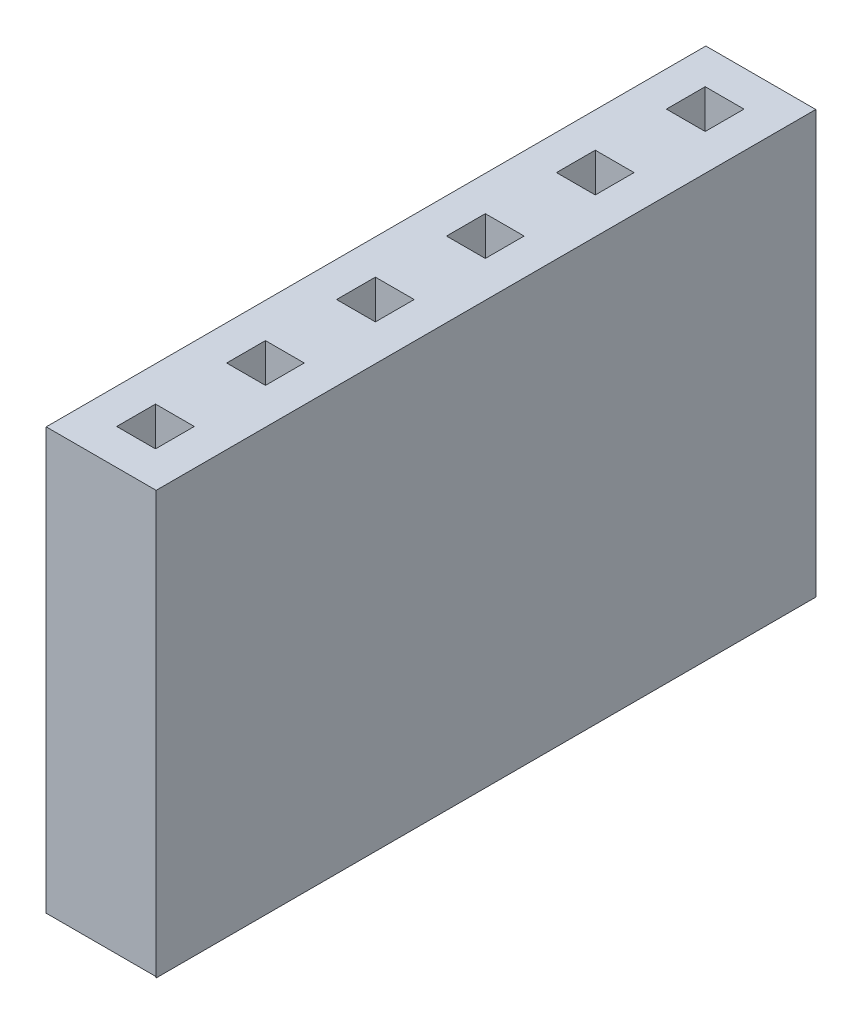
from build123d import *

# Parameters (mm, degrees)
SKETCH1_W           = 2.83333
SKETCH1_H           = 2.83333
BOSS_EXTRUDE2_DEPTH = 11
SKETCH2_W           = 1
SKETCH2_H           = 1
CUT_EXTRUDE1_DEPTH  = 11
LPATTERN6_COUNT     = 6
LPATTERN6_PITCH     = 2.8333


with BuildPart() as part:
    # Sketch1 → Boss-Extrude2 (new body)
    with BuildSketch(Plane(origin=(0, 0, 0), x_dir=(1, 0, 0), z_dir=(0, 1, 0))):
        with Locations((1.416665, 1.416665)):
            Rectangle(SKETCH1_W, SKETCH1_H)
    boss_extrude2 = extrude(amount=BOSS_EXTRUDE2_DEPTH)

    # Sketch2 → Cut-Extrude1 (cut)
    with BuildSketch(Plane(origin=(0, 0, 0), x_dir=(-1, 0, 0), z_dir=(0, -1, 0))):
        with Locations((-1.4, 1.416665)):
            Rectangle(SKETCH2_W, SKETCH2_H)
    cut_extrude1 = extrude(amount=-CUT_EXTRUDE1_DEPTH, mode=Mode.SUBTRACT)

    # Chamfer7
    # the kernel refuses this chamfer: 1.732050808, 1 mm, written as the material it takes off along each edge
    with BuildSketch(Plane(origin=(1.9, 0, -0.916665), x_dir=(0, -0.05789386240267139, 0.9983227437537926), z_dir=(-1, 0, 0)), Plane(origin=(0.9, 0, -0.916665), x_dir=(-0.9983227437537926, -0.0578938624026714, 0), z_dir=(0, 0, -1)), Plane(origin=(0.9, 0, -1.916665), x_dir=(0, -0.05789386240267139, -0.9983227437537926), z_dir=(1, 0, 0)), Plane(origin=(1.9, 0, -1.916665), x_dir=(0.9983227437537926, -0.05789386240267139, 0), z_dir=(0, 0, 1))) as chamfer7_piece_1:
        with BuildLine():
            Line((1.03637929, 0), (-0.138331657, 1.787039577))
            Line((-0.138331657, 1.787039577), (-0.172914571, 1.785034075))
            ThreePointArc((-0.172914571, 1.785034075), (-0.086457286, 0.892517037), (-0.034582914, -0.002005502))
            Line((-0.034582914, -0.002005502), (0.002005502, -0.034582914))
            ThreePointArc((0.002005502, -0.034582914), (0.518458331, -0.004633232), (1.038384792, -0.034582914))
            Line((1.038384792, -0.034582914), (1.03637929, 0))
        make_face()
    extrude(amount=1, mode=Mode.SUBTRACT)
    with BuildSketch(Plane(origin=(1.9, 0, -1.916665), x_dir=(0.9983227437537926, -0.05789386240267139, 0), z_dir=(0, 0, 1))) as chamfer7_piece_2a_section:
        with BuildLine():
            Line((1.03637929, 0), (-0.138331657, 1.787039577))
            Line((-0.138331657, 1.787039577), (-0.172914571, 1.785034075))
            ThreePointArc((-0.172914571, 1.785034075), (-0.086457286, 0.892517037), (-0.034582914, -0.002005502))
            Line((-0.034582914, -0.002005502), (0.002005502, -0.034582914))
            ThreePointArc((0.002005502, -0.034582914), (0.518458331, -0.004633232), (1.038384792, -0.034582914))
            Line((1.038384792, -0.034582914), (1.03637929, 0))
        make_face()
    chamfer7_piece_2a = extrude(amount=5.480963971, mode=Mode.PRIVATE)
    chamfer7_piece_2a = split(chamfer7_piece_2a, bisect_by=Plane(origin=(2.220669895, 0.580899134, -0.916665), z_dir=(0, 0, 1)), keep=Keep.TOP, mode=Mode.PRIVATE)
    with BuildSketch(Plane(origin=(6.380963971, 0, -0.916665), x_dir=(0, -0.05789386240267139, 0.9983227437537926), z_dir=(-1, 0, 0))) as chamfer7_piece_2b_section:
        with BuildLine():
            Line((1.03637929, 0), (-0.138331657, 1.787039577))
            Line((-0.138331657, 1.787039577), (-0.172914571, 1.785034075))
            ThreePointArc((-0.172914571, 1.785034075), (-0.086457286, 0.892517037), (-0.034582914, -0.002005502))
            Line((-0.034582914, -0.002005502), (0.002005502, -0.034582914))
            ThreePointArc((0.002005502, -0.034582914), (0.518458331, -0.004633232), (1.038384792, -0.034582914))
            Line((1.038384792, -0.034582914), (1.03637929, 0))
        make_face()
    chamfer7_piece_2b = extrude(amount=5.480963971, mode=Mode.PRIVATE)
    chamfer7_piece_2b = split(chamfer7_piece_2b, bisect_by=Plane(origin=(1.9, 0.580899134, -0.595995105), z_dir=(1, 0, 0)), keep=Keep.TOP, mode=Mode.PRIVATE)
    chamfer7_piece_2 = chamfer7_piece_2a & chamfer7_piece_2b
    add(chamfer7_piece_2, mode=Mode.SUBTRACT)
    with BuildSketch(Plane(origin=(0.9, 0, 3.564298971), x_dir=(-0.9983227437537926, -0.0578938624026714, 0), z_dir=(0, 0, -1))) as chamfer7_piece_3a_section:
        with BuildLine():
            Line((1.03637929, 0), (-0.138331657, 1.787039577))
            Line((-0.138331657, 1.787039577), (-0.172914571, 1.785034075))
            ThreePointArc((-0.172914571, 1.785034075), (-0.086457286, 0.892517037), (-0.034582914, -0.002005502))
            Line((-0.034582914, -0.002005502), (0.002005502, -0.034582914))
            ThreePointArc((0.002005502, -0.034582914), (0.518458331, -0.004633232), (1.038384792, -0.034582914))
            Line((1.038384792, -0.034582914), (1.03637929, 0))
        make_face()
    chamfer7_piece_3a = extrude(amount=5.480963971, mode=Mode.PRIVATE)
    chamfer7_piece_3a = split(chamfer7_piece_3a, bisect_by=Plane(origin=(0.579330105, 0.580899134, -0.916665), z_dir=(0, 0, 1)), keep=Keep.TOP, mode=Mode.PRIVATE)
    with BuildSketch(Plane(origin=(1.9, 0, -0.916665), x_dir=(0, -0.05789386240267139, 0.9983227437537926), z_dir=(-1, 0, 0))) as chamfer7_piece_3b_section:
        with BuildLine():
            Line((1.03637929, 0), (-0.138331657, 1.787039577))
            Line((-0.138331657, 1.787039577), (-0.172914571, 1.785034075))
            ThreePointArc((-0.172914571, 1.785034075), (-0.086457286, 0.892517037), (-0.034582914, -0.002005502))
            Line((-0.034582914, -0.002005502), (0.002005502, -0.034582914))
            ThreePointArc((0.002005502, -0.034582914), (0.518458331, -0.004633232), (1.038384792, -0.034582914))
            Line((1.038384792, -0.034582914), (1.03637929, 0))
        make_face()
    chamfer7_piece_3b = extrude(amount=5.480963971, mode=Mode.PRIVATE)
    chamfer7_piece_3b = split(chamfer7_piece_3b, bisect_by=Plane(origin=(0.9, 0.580899134, -0.595995105), z_dir=(-1, 0, 0)), keep=Keep.TOP, mode=Mode.PRIVATE)
    chamfer7_piece_3 = chamfer7_piece_3a & chamfer7_piece_3b
    add(chamfer7_piece_3, mode=Mode.SUBTRACT)
    with BuildSketch(Plane(origin=(-3.580963971, 0, -1.916665), x_dir=(0, -0.05789386240267139, -0.9983227437537926), z_dir=(1, 0, 0))) as chamfer7_piece_4a_section:
        with BuildLine():
            Line((1.03637929, 0), (-0.138331657, 1.787039577))
            Line((-0.138331657, 1.787039577), (-0.172914571, 1.785034075))
            ThreePointArc((-0.172914571, 1.785034075), (-0.086457286, 0.892517037), (-0.034582914, -0.002005502))
            Line((-0.034582914, -0.002005502), (0.002005502, -0.034582914))
            ThreePointArc((0.002005502, -0.034582914), (0.518458331, -0.004633232), (1.038384792, -0.034582914))
            Line((1.038384792, -0.034582914), (1.03637929, 0))
        make_face()
    chamfer7_piece_4a = extrude(amount=5.480963971, mode=Mode.PRIVATE)
    chamfer7_piece_4a = split(chamfer7_piece_4a, bisect_by=Plane(origin=(0.9, 0.580899134, -2.237334895), z_dir=(-1, 0, 0)), keep=Keep.TOP, mode=Mode.PRIVATE)
    with BuildSketch(Plane(origin=(0.9, 0, -0.916665), x_dir=(-0.9983227437537926, -0.0578938624026714, 0), z_dir=(0, 0, -1))) as chamfer7_piece_4b_section:
        with BuildLine():
            Line((1.03637929, 0), (-0.138331657, 1.787039577))
            Line((-0.138331657, 1.787039577), (-0.172914571, 1.785034075))
            ThreePointArc((-0.172914571, 1.785034075), (-0.086457286, 0.892517037), (-0.034582914, -0.002005502))
            Line((-0.034582914, -0.002005502), (0.002005502, -0.034582914))
            ThreePointArc((0.002005502, -0.034582914), (0.518458331, -0.004633232), (1.038384792, -0.034582914))
            Line((1.038384792, -0.034582914), (1.03637929, 0))
        make_face()
    chamfer7_piece_4b = extrude(amount=5.480963971, mode=Mode.PRIVATE)
    chamfer7_piece_4b = split(chamfer7_piece_4b, bisect_by=Plane(origin=(0.579330105, 0.580899134, -1.916665), z_dir=(0, 0, -1)), keep=Keep.TOP, mode=Mode.PRIVATE)
    chamfer7_piece_4 = chamfer7_piece_4a & chamfer7_piece_4b
    add(chamfer7_piece_4, mode=Mode.SUBTRACT)
    with BuildSketch(Plane(origin=(1.9, 0, -6.397628971), x_dir=(0.9983227437537926, -0.05789386240267139, 0), z_dir=(0, 0, 1))) as chamfer7_piece_5a_section:
        with BuildLine():
            Line((1.03637929, 0), (-0.138331657, 1.787039577))
            Line((-0.138331657, 1.787039577), (-0.172914571, 1.785034075))
            ThreePointArc((-0.172914571, 1.785034075), (-0.086457286, 0.892517037), (-0.034582914, -0.002005502))
            Line((-0.034582914, -0.002005502), (0.002005502, -0.034582914))
            ThreePointArc((0.002005502, -0.034582914), (0.518458331, -0.004633232), (1.038384792, -0.034582914))
            Line((1.038384792, -0.034582914), (1.03637929, 0))
        make_face()
    chamfer7_piece_5a = extrude(amount=5.480963971, mode=Mode.PRIVATE)
    chamfer7_piece_5a = split(chamfer7_piece_5a, bisect_by=Plane(origin=(2.220669895, 0.580899134, -1.916665), z_dir=(0, 0, -1)), keep=Keep.TOP, mode=Mode.PRIVATE)
    with BuildSketch(Plane(origin=(0.9, 0, -1.916665), x_dir=(0, -0.05789386240267139, -0.9983227437537926), z_dir=(1, 0, 0))) as chamfer7_piece_5b_section:
        with BuildLine():
            Line((1.03637929, 0), (-0.138331657, 1.787039577))
            Line((-0.138331657, 1.787039577), (-0.172914571, 1.785034075))
            ThreePointArc((-0.172914571, 1.785034075), (-0.086457286, 0.892517037), (-0.034582914, -0.002005502))
            Line((-0.034582914, -0.002005502), (0.002005502, -0.034582914))
            ThreePointArc((0.002005502, -0.034582914), (0.518458331, -0.004633232), (1.038384792, -0.034582914))
            Line((1.038384792, -0.034582914), (1.03637929, 0))
        make_face()
    chamfer7_piece_5b = extrude(amount=5.480963971, mode=Mode.PRIVATE)
    chamfer7_piece_5b = split(chamfer7_piece_5b, bisect_by=Plane(origin=(1.9, 0.580899134, -2.237334895), z_dir=(1, 0, 0)), keep=Keep.TOP, mode=Mode.PRIVATE)
    chamfer7_piece_5 = chamfer7_piece_5a & chamfer7_piece_5b
    add(chamfer7_piece_5, mode=Mode.SUBTRACT)

    # LPattern6: Boss-Extrude2, Cut-Extrude1 ×6
    with Locations(*[(0, 0, i * LPATTERN6_PITCH) for i in range(1, LPATTERN6_COUNT)]):
        add(boss_extrude2)
        add(cut_extrude1, mode=Mode.SUBTRACT)

    # Chamfer7 of LPattern6
    # the kernel refuses this chamfer: 1.732050808, 1 mm, written as the material it takes off along each edge
    with BuildSketch(Plane(origin=(1.9, 0, 1.916635), x_dir=(0, -0.05789386240267139, 0.9983227437537926), z_dir=(-1, 0, 0)), Plane(origin=(0.9, 0, 1.916635), x_dir=(-0.9983227437537926, -0.0578938624026714, 0), z_dir=(0, 0, -1)), Plane(origin=(0.9, 0, 0.916635), x_dir=(0, -0.05789386240267139, -0.9983227437537926), z_dir=(1, 0, 0)), Plane(origin=(1.9, 0, 0.916635), x_dir=(0.9983227437537926, -0.05789386240267139, 0), z_dir=(0, 0, 1)), Plane(origin=(1.9, 0, 4.749935), x_dir=(0, -0.05789386240267139, 0.9983227437537926), z_dir=(-1, 0, 0)), Plane(origin=(0.9, 0, 4.749935), x_dir=(-0.9983227437537926, -0.05789386240267139, 0), z_dir=(0, 0, -1)), Plane(origin=(0.9, 0, 3.749935), x_dir=(0, -0.05789386240267139, -0.9983227437537926), z_dir=(1, 0, 0)), Plane(origin=(1.9, 0, 3.749935), x_dir=(0.9983227437537926, -0.05789386240267139, 0), z_dir=(0, 0, 1)), Plane(origin=(1.9, 0, 7.583235), x_dir=(0, -0.05789386240267145, 0.9983227437537926), z_dir=(-1, 0, 0)), Plane(origin=(0.9, 0, 7.583235), x_dir=(-0.9983227437537926, -0.05789386240267139, 0), z_dir=(0, 0, -1)), Plane(origin=(0.9, 0, 6.583235), x_dir=(0, -0.05789386240267139, -0.9983227437537926), z_dir=(1, 0, 0)), Plane(origin=(1.9, 0, 6.583235), x_dir=(0.9983227437537926, -0.0578938624026714, 0), z_dir=(0, 0, 1)), Plane(origin=(1.9, 0, 10.416535), x_dir=(0, -0.05789386240267139, 0.9983227437537926), z_dir=(-1, 0, 0)), Plane(origin=(0.9, 0, 10.416535), x_dir=(-0.9983227437537926, -0.05789386240267139, 0), z_dir=(0, 0, -1)), Plane(origin=(0.9, 0, 9.416535), x_dir=(0, -0.05789386240267139, -0.9983227437537926), z_dir=(1, 0, 0)), Plane(origin=(1.9, 0, 9.416535), x_dir=(0.9983227437537926, -0.0578938624026714, 0), z_dir=(0, 0, 1)), Plane(origin=(1.9, 0, 13.249835), x_dir=(0, -0.05789386240267139, 0.9983227437537926), z_dir=(-1, 0, 0)), Plane(origin=(0.9, 0, 13.249835), x_dir=(-0.9983227437537926, -0.05789386240267139, 0), z_dir=(0, 0, -1)), Plane(origin=(0.9, 0, 12.249835), x_dir=(0, -0.05789386240267139, -0.9983227437537926), z_dir=(1, 0, 0)), Plane(origin=(1.9, 0, 12.249835), x_dir=(0.9983227437537926, -0.0578938624026714, 0), z_dir=(0, 0, 1))) as chamfer7_of_lpattern6_piece_1:
        with BuildLine():
            Line((1.03637929, 0), (-0.138331657, 1.787039577))
            Line((-0.138331657, 1.787039577), (-0.172914571, 1.785034075))
            ThreePointArc((-0.172914571, 1.785034075), (-0.086457286, 0.892517037), (-0.034582914, -0.002005502))
            Line((-0.034582914, -0.002005502), (0.002005502, -0.034582914))
            ThreePointArc((0.002005502, -0.034582914), (0.518458331, -0.004633232), (1.038384792, -0.034582914))
            Line((1.038384792, -0.034582914), (1.03637929, 0))
        make_face()
    extrude(amount=1, mode=Mode.SUBTRACT)
    with BuildSketch(Plane(origin=(1.9, 0, 0.916635), x_dir=(0.9983227437537926, -0.05789386240267139, 0), z_dir=(0, 0, 1))) as chamfer7_of_lpattern6_piece_2a_section:
        with BuildLine():
            Line((1.03637929, 0), (-0.138331657, 1.787039577))
            Line((-0.138331657, 1.787039577), (-0.172914571, 1.785034075))
            ThreePointArc((-0.172914571, 1.785034075), (-0.086457286, 0.892517037), (-0.034582914, -0.002005502))
            Line((-0.034582914, -0.002005502), (0.002005502, -0.034582914))
            ThreePointArc((0.002005502, -0.034582914), (0.518458331, -0.004633232), (1.038384792, -0.034582914))
            Line((1.038384792, -0.034582914), (1.03637929, 0))
        make_face()
    chamfer7_of_lpattern6_piece_2a = extrude(amount=5.480963971, mode=Mode.PRIVATE)
    chamfer7_of_lpattern6_piece_2a = split(chamfer7_of_lpattern6_piece_2a, bisect_by=Plane(origin=(2.220669895, 0.580899134, 1.916635), z_dir=(0, 0, 1)), keep=Keep.TOP, mode=Mode.PRIVATE)
    with BuildSketch(Plane(origin=(6.380963971, 0, 1.916635), x_dir=(0, -0.05789386240267139, 0.9983227437537926), z_dir=(-1, 0, 0))) as chamfer7_of_lpattern6_piece_2b_section:
        with BuildLine():
            Line((1.03637929, 0), (-0.138331657, 1.787039577))
            Line((-0.138331657, 1.787039577), (-0.172914571, 1.785034075))
            ThreePointArc((-0.172914571, 1.785034075), (-0.086457286, 0.892517037), (-0.034582914, -0.002005502))
            Line((-0.034582914, -0.002005502), (0.002005502, -0.034582914))
            ThreePointArc((0.002005502, -0.034582914), (0.518458331, -0.004633232), (1.038384792, -0.034582914))
            Line((1.038384792, -0.034582914), (1.03637929, 0))
        make_face()
    chamfer7_of_lpattern6_piece_2b = extrude(amount=5.480963971, mode=Mode.PRIVATE)
    chamfer7_of_lpattern6_piece_2b = split(chamfer7_of_lpattern6_piece_2b, bisect_by=Plane(origin=(1.9, 0.580899134, 2.237304895), z_dir=(1, 0, 0)), keep=Keep.TOP, mode=Mode.PRIVATE)
    chamfer7_of_lpattern6_piece_2 = chamfer7_of_lpattern6_piece_2a & chamfer7_of_lpattern6_piece_2b
    add(chamfer7_of_lpattern6_piece_2, mode=Mode.SUBTRACT)
    with BuildSketch(Plane(origin=(1.9, 0, 1.916635), x_dir=(0, -0.05789386240267139, 0.9983227437537926), z_dir=(-1, 0, 0))) as chamfer7_of_lpattern6_piece_3a_section:
        with BuildLine():
            Line((1.03637929, 0), (-0.138331657, 1.787039577))
            Line((-0.138331657, 1.787039577), (-0.172914571, 1.785034075))
            ThreePointArc((-0.172914571, 1.785034075), (-0.086457286, 0.892517037), (-0.034582914, -0.002005502))
            Line((-0.034582914, -0.002005502), (0.002005502, -0.034582914))
            ThreePointArc((0.002005502, -0.034582914), (0.518458331, -0.004633232), (1.038384792, -0.034582914))
            Line((1.038384792, -0.034582914), (1.03637929, 0))
        make_face()
    chamfer7_of_lpattern6_piece_3a = extrude(amount=5.480963971, mode=Mode.PRIVATE)
    chamfer7_of_lpattern6_piece_3a = split(chamfer7_of_lpattern6_piece_3a, bisect_by=Plane(origin=(0.9, 0.580899134, 2.237304895), z_dir=(-1, 0, 0)), keep=Keep.TOP, mode=Mode.PRIVATE)
    with BuildSketch(Plane(origin=(0.9, 0, 6.397598971), x_dir=(-0.9983227437537926, -0.0578938624026714, 0), z_dir=(0, 0, -1))) as chamfer7_of_lpattern6_piece_3b_section:
        with BuildLine():
            Line((1.03637929, 0), (-0.138331657, 1.787039577))
            Line((-0.138331657, 1.787039577), (-0.172914571, 1.785034075))
            ThreePointArc((-0.172914571, 1.785034075), (-0.086457286, 0.892517037), (-0.034582914, -0.002005502))
            Line((-0.034582914, -0.002005502), (0.002005502, -0.034582914))
            ThreePointArc((0.002005502, -0.034582914), (0.518458331, -0.004633232), (1.038384792, -0.034582914))
            Line((1.038384792, -0.034582914), (1.03637929, 0))
        make_face()
    chamfer7_of_lpattern6_piece_3b = extrude(amount=5.480963971, mode=Mode.PRIVATE)
    chamfer7_of_lpattern6_piece_3b = split(chamfer7_of_lpattern6_piece_3b, bisect_by=Plane(origin=(0.579330105, 0.580899134, 1.916635), z_dir=(0, 0, 1)), keep=Keep.TOP, mode=Mode.PRIVATE)
    chamfer7_of_lpattern6_piece_3 = chamfer7_of_lpattern6_piece_3a & chamfer7_of_lpattern6_piece_3b
    add(chamfer7_of_lpattern6_piece_3, mode=Mode.SUBTRACT)
    with BuildSketch(Plane(origin=(-3.580963971, 0, 0.916635), x_dir=(0, -0.05789386240267139, -0.9983227437537926), z_dir=(1, 0, 0))) as chamfer7_of_lpattern6_piece_4a_section:
        with BuildLine():
            Line((1.03637929, 0), (-0.138331657, 1.787039577))
            Line((-0.138331657, 1.787039577), (-0.172914571, 1.785034075))
            ThreePointArc((-0.172914571, 1.785034075), (-0.086457286, 0.892517037), (-0.034582914, -0.002005502))
            Line((-0.034582914, -0.002005502), (0.002005502, -0.034582914))
            ThreePointArc((0.002005502, -0.034582914), (0.518458331, -0.004633232), (1.038384792, -0.034582914))
            Line((1.038384792, -0.034582914), (1.03637929, 0))
        make_face()
    chamfer7_of_lpattern6_piece_4a = extrude(amount=5.480963971, mode=Mode.PRIVATE)
    chamfer7_of_lpattern6_piece_4a = split(chamfer7_of_lpattern6_piece_4a, bisect_by=Plane(origin=(0.9, 0.580899134, 0.595965105), z_dir=(-1, 0, 0)), keep=Keep.TOP, mode=Mode.PRIVATE)
    with BuildSketch(Plane(origin=(0.9, 0, 1.916635), x_dir=(-0.9983227437537926, -0.0578938624026714, 0), z_dir=(0, 0, -1))) as chamfer7_of_lpattern6_piece_4b_section:
        with BuildLine():
            Line((1.03637929, 0), (-0.138331657, 1.787039577))
            Line((-0.138331657, 1.787039577), (-0.172914571, 1.785034075))
            ThreePointArc((-0.172914571, 1.785034075), (-0.086457286, 0.892517037), (-0.034582914, -0.002005502))
            Line((-0.034582914, -0.002005502), (0.002005502, -0.034582914))
            ThreePointArc((0.002005502, -0.034582914), (0.518458331, -0.004633232), (1.038384792, -0.034582914))
            Line((1.038384792, -0.034582914), (1.03637929, 0))
        make_face()
    chamfer7_of_lpattern6_piece_4b = extrude(amount=5.480963971, mode=Mode.PRIVATE)
    chamfer7_of_lpattern6_piece_4b = split(chamfer7_of_lpattern6_piece_4b, bisect_by=Plane(origin=(0.579330105, 0.580899134, 0.916635), z_dir=(0, 0, -1)), keep=Keep.TOP, mode=Mode.PRIVATE)
    chamfer7_of_lpattern6_piece_4 = chamfer7_of_lpattern6_piece_4a & chamfer7_of_lpattern6_piece_4b
    add(chamfer7_of_lpattern6_piece_4, mode=Mode.SUBTRACT)
    with BuildSketch(Plane(origin=(1.9, 0, -3.564328971), x_dir=(0.9983227437537926, -0.05789386240267139, 0), z_dir=(0, 0, 1))) as chamfer7_of_lpattern6_piece_5a_section:
        with BuildLine():
            Line((1.03637929, 0), (-0.138331657, 1.787039577))
            Line((-0.138331657, 1.787039577), (-0.172914571, 1.785034075))
            ThreePointArc((-0.172914571, 1.785034075), (-0.086457286, 0.892517037), (-0.034582914, -0.002005502))
            Line((-0.034582914, -0.002005502), (0.002005502, -0.034582914))
            ThreePointArc((0.002005502, -0.034582914), (0.518458331, -0.004633232), (1.038384792, -0.034582914))
            Line((1.038384792, -0.034582914), (1.03637929, 0))
        make_face()
    chamfer7_of_lpattern6_piece_5a = extrude(amount=5.480963971, mode=Mode.PRIVATE)
    chamfer7_of_lpattern6_piece_5a = split(chamfer7_of_lpattern6_piece_5a, bisect_by=Plane(origin=(2.220669895, 0.580899134, 0.916635), z_dir=(0, 0, -1)), keep=Keep.TOP, mode=Mode.PRIVATE)
    with BuildSketch(Plane(origin=(0.9, 0, 0.916635), x_dir=(0, -0.05789386240267139, -0.9983227437537926), z_dir=(1, 0, 0))) as chamfer7_of_lpattern6_piece_5b_section:
        with BuildLine():
            Line((1.03637929, 0), (-0.138331657, 1.787039577))
            Line((-0.138331657, 1.787039577), (-0.172914571, 1.785034075))
            ThreePointArc((-0.172914571, 1.785034075), (-0.086457286, 0.892517037), (-0.034582914, -0.002005502))
            Line((-0.034582914, -0.002005502), (0.002005502, -0.034582914))
            ThreePointArc((0.002005502, -0.034582914), (0.518458331, -0.004633232), (1.038384792, -0.034582914))
            Line((1.038384792, -0.034582914), (1.03637929, 0))
        make_face()
    chamfer7_of_lpattern6_piece_5b = extrude(amount=5.480963971, mode=Mode.PRIVATE)
    chamfer7_of_lpattern6_piece_5b = split(chamfer7_of_lpattern6_piece_5b, bisect_by=Plane(origin=(1.9, 0.580899134, 0.595965105), z_dir=(1, 0, 0)), keep=Keep.TOP, mode=Mode.PRIVATE)
    chamfer7_of_lpattern6_piece_5 = chamfer7_of_lpattern6_piece_5a & chamfer7_of_lpattern6_piece_5b
    add(chamfer7_of_lpattern6_piece_5, mode=Mode.SUBTRACT)
    with BuildSketch(Plane(origin=(1.9, 0, 3.749935), x_dir=(0.9983227437537926, -0.05789386240267139, 0), z_dir=(0, 0, 1))) as chamfer7_of_lpattern6_piece_6a_section:
        with BuildLine():
            Line((1.03637929, 0), (-0.138331657, 1.787039577))
            Line((-0.138331657, 1.787039577), (-0.172914571, 1.785034075))
            ThreePointArc((-0.172914571, 1.785034075), (-0.086457286, 0.892517037), (-0.034582914, -0.002005502))
            Line((-0.034582914, -0.002005502), (0.002005502, -0.034582914))
            ThreePointArc((0.002005502, -0.034582914), (0.518458331, -0.004633232), (1.038384792, -0.034582914))
            Line((1.038384792, -0.034582914), (1.03637929, 0))
        make_face()
    chamfer7_of_lpattern6_piece_6a = extrude(amount=5.480963971, mode=Mode.PRIVATE)
    chamfer7_of_lpattern6_piece_6a = split(chamfer7_of_lpattern6_piece_6a, bisect_by=Plane(origin=(2.220669895, 0.580899134, 4.749935), z_dir=(0, 0, 1)), keep=Keep.TOP, mode=Mode.PRIVATE)
    with BuildSketch(Plane(origin=(6.380963971, 0, 4.749935), x_dir=(0, -0.05789386240267139, 0.9983227437537926), z_dir=(-1, 0, 0))) as chamfer7_of_lpattern6_piece_6b_section:
        with BuildLine():
            Line((1.03637929, 0), (-0.138331657, 1.787039577))
            Line((-0.138331657, 1.787039577), (-0.172914571, 1.785034075))
            ThreePointArc((-0.172914571, 1.785034075), (-0.086457286, 0.892517037), (-0.034582914, -0.002005502))
            Line((-0.034582914, -0.002005502), (0.002005502, -0.034582914))
            ThreePointArc((0.002005502, -0.034582914), (0.518458331, -0.004633232), (1.038384792, -0.034582914))
            Line((1.038384792, -0.034582914), (1.03637929, 0))
        make_face()
    chamfer7_of_lpattern6_piece_6b = extrude(amount=5.480963971, mode=Mode.PRIVATE)
    chamfer7_of_lpattern6_piece_6b = split(chamfer7_of_lpattern6_piece_6b, bisect_by=Plane(origin=(1.9, 0.580899134, 5.070604895), z_dir=(1, 0, 0)), keep=Keep.TOP, mode=Mode.PRIVATE)
    chamfer7_of_lpattern6_piece_6 = chamfer7_of_lpattern6_piece_6a & chamfer7_of_lpattern6_piece_6b
    add(chamfer7_of_lpattern6_piece_6, mode=Mode.SUBTRACT)
    with BuildSketch(Plane(origin=(1.9, 0, 4.749935), x_dir=(0, -0.05789386240267139, 0.9983227437537926), z_dir=(-1, 0, 0))) as chamfer7_of_lpattern6_piece_7a_section:
        with BuildLine():
            Line((1.03637929, 0), (-0.138331657, 1.787039577))
            Line((-0.138331657, 1.787039577), (-0.172914571, 1.785034075))
            ThreePointArc((-0.172914571, 1.785034075), (-0.086457286, 0.892517037), (-0.034582914, -0.002005502))
            Line((-0.034582914, -0.002005502), (0.002005502, -0.034582914))
            ThreePointArc((0.002005502, -0.034582914), (0.518458331, -0.004633232), (1.038384792, -0.034582914))
            Line((1.038384792, -0.034582914), (1.03637929, 0))
        make_face()
    chamfer7_of_lpattern6_piece_7a = extrude(amount=5.480963971, mode=Mode.PRIVATE)
    chamfer7_of_lpattern6_piece_7a = split(chamfer7_of_lpattern6_piece_7a, bisect_by=Plane(origin=(0.9, 0.580899134, 5.070604895), z_dir=(-1, 0, 0)), keep=Keep.TOP, mode=Mode.PRIVATE)
    with BuildSketch(Plane(origin=(0.9, 0, 9.230898971), x_dir=(-0.9983227437537926, -0.05789386240267139, 0), z_dir=(0, 0, -1))) as chamfer7_of_lpattern6_piece_7b_section:
        with BuildLine():
            Line((1.03637929, 0), (-0.138331657, 1.787039577))
            Line((-0.138331657, 1.787039577), (-0.172914571, 1.785034075))
            ThreePointArc((-0.172914571, 1.785034075), (-0.086457286, 0.892517037), (-0.034582914, -0.002005502))
            Line((-0.034582914, -0.002005502), (0.002005502, -0.034582914))
            ThreePointArc((0.002005502, -0.034582914), (0.518458331, -0.004633232), (1.038384792, -0.034582914))
            Line((1.038384792, -0.034582914), (1.03637929, 0))
        make_face()
    chamfer7_of_lpattern6_piece_7b = extrude(amount=5.480963971, mode=Mode.PRIVATE)
    chamfer7_of_lpattern6_piece_7b = split(chamfer7_of_lpattern6_piece_7b, bisect_by=Plane(origin=(0.579330105, 0.580899134, 4.749935), z_dir=(0, 0, 1)), keep=Keep.TOP, mode=Mode.PRIVATE)
    chamfer7_of_lpattern6_piece_7 = chamfer7_of_lpattern6_piece_7a & chamfer7_of_lpattern6_piece_7b
    add(chamfer7_of_lpattern6_piece_7, mode=Mode.SUBTRACT)
    with BuildSketch(Plane(origin=(-3.580963971, 0, 3.749935), x_dir=(0, -0.05789386240267139, -0.9983227437537926), z_dir=(1, 0, 0))) as chamfer7_of_lpattern6_piece_8a_section:
        with BuildLine():
            Line((1.03637929, 0), (-0.138331657, 1.787039577))
            Line((-0.138331657, 1.787039577), (-0.172914571, 1.785034075))
            ThreePointArc((-0.172914571, 1.785034075), (-0.086457286, 0.892517037), (-0.034582914, -0.002005502))
            Line((-0.034582914, -0.002005502), (0.002005502, -0.034582914))
            ThreePointArc((0.002005502, -0.034582914), (0.518458331, -0.004633232), (1.038384792, -0.034582914))
            Line((1.038384792, -0.034582914), (1.03637929, 0))
        make_face()
    chamfer7_of_lpattern6_piece_8a = extrude(amount=5.480963971, mode=Mode.PRIVATE)
    chamfer7_of_lpattern6_piece_8a = split(chamfer7_of_lpattern6_piece_8a, bisect_by=Plane(origin=(0.9, 0.580899134, 3.429265105), z_dir=(-1, 0, 0)), keep=Keep.TOP, mode=Mode.PRIVATE)
    with BuildSketch(Plane(origin=(0.9, 0, 4.749935), x_dir=(-0.9983227437537926, -0.05789386240267139, 0), z_dir=(0, 0, -1))) as chamfer7_of_lpattern6_piece_8b_section:
        with BuildLine():
            Line((1.03637929, 0), (-0.138331657, 1.787039577))
            Line((-0.138331657, 1.787039577), (-0.172914571, 1.785034075))
            ThreePointArc((-0.172914571, 1.785034075), (-0.086457286, 0.892517037), (-0.034582914, -0.002005502))
            Line((-0.034582914, -0.002005502), (0.002005502, -0.034582914))
            ThreePointArc((0.002005502, -0.034582914), (0.518458331, -0.004633232), (1.038384792, -0.034582914))
            Line((1.038384792, -0.034582914), (1.03637929, 0))
        make_face()
    chamfer7_of_lpattern6_piece_8b = extrude(amount=5.480963971, mode=Mode.PRIVATE)
    chamfer7_of_lpattern6_piece_8b = split(chamfer7_of_lpattern6_piece_8b, bisect_by=Plane(origin=(0.579330105, 0.580899134, 3.749935), z_dir=(0, 0, -1)), keep=Keep.TOP, mode=Mode.PRIVATE)
    chamfer7_of_lpattern6_piece_8 = chamfer7_of_lpattern6_piece_8a & chamfer7_of_lpattern6_piece_8b
    add(chamfer7_of_lpattern6_piece_8, mode=Mode.SUBTRACT)
    with BuildSketch(Plane(origin=(1.9, 0, -0.731028971), x_dir=(0.9983227437537926, -0.05789386240267139, 0), z_dir=(0, 0, 1))) as chamfer7_of_lpattern6_piece_9a_section:
        with BuildLine():
            Line((1.03637929, 0), (-0.138331657, 1.787039577))
            Line((-0.138331657, 1.787039577), (-0.172914571, 1.785034075))
            ThreePointArc((-0.172914571, 1.785034075), (-0.086457286, 0.892517037), (-0.034582914, -0.002005502))
            Line((-0.034582914, -0.002005502), (0.002005502, -0.034582914))
            ThreePointArc((0.002005502, -0.034582914), (0.518458331, -0.004633232), (1.038384792, -0.034582914))
            Line((1.038384792, -0.034582914), (1.03637929, 0))
        make_face()
    chamfer7_of_lpattern6_piece_9a = extrude(amount=5.480963971, mode=Mode.PRIVATE)
    chamfer7_of_lpattern6_piece_9a = split(chamfer7_of_lpattern6_piece_9a, bisect_by=Plane(origin=(2.220669895, 0.580899134, 3.749935), z_dir=(0, 0, -1)), keep=Keep.TOP, mode=Mode.PRIVATE)
    with BuildSketch(Plane(origin=(0.9, 0, 3.749935), x_dir=(0, -0.05789386240267139, -0.9983227437537926), z_dir=(1, 0, 0))) as chamfer7_of_lpattern6_piece_9b_section:
        with BuildLine():
            Line((1.03637929, 0), (-0.138331657, 1.787039577))
            Line((-0.138331657, 1.787039577), (-0.172914571, 1.785034075))
            ThreePointArc((-0.172914571, 1.785034075), (-0.086457286, 0.892517037), (-0.034582914, -0.002005502))
            Line((-0.034582914, -0.002005502), (0.002005502, -0.034582914))
            ThreePointArc((0.002005502, -0.034582914), (0.518458331, -0.004633232), (1.038384792, -0.034582914))
            Line((1.038384792, -0.034582914), (1.03637929, 0))
        make_face()
    chamfer7_of_lpattern6_piece_9b = extrude(amount=5.480963971, mode=Mode.PRIVATE)
    chamfer7_of_lpattern6_piece_9b = split(chamfer7_of_lpattern6_piece_9b, bisect_by=Plane(origin=(1.9, 0.580899134, 3.429265105), z_dir=(1, 0, 0)), keep=Keep.TOP, mode=Mode.PRIVATE)
    chamfer7_of_lpattern6_piece_9 = chamfer7_of_lpattern6_piece_9a & chamfer7_of_lpattern6_piece_9b
    add(chamfer7_of_lpattern6_piece_9, mode=Mode.SUBTRACT)
    with BuildSketch(Plane(origin=(1.9, 0, 6.583235), x_dir=(0.9983227437537926, -0.0578938624026714, 0), z_dir=(0, 0, 1))) as chamfer7_of_lpattern6_piece_10a_section:
        with BuildLine():
            Line((1.03637929, 0), (-0.138331657, 1.787039577))
            Line((-0.138331657, 1.787039577), (-0.172914571, 1.785034075))
            ThreePointArc((-0.172914571, 1.785034075), (-0.086457286, 0.892517037), (-0.034582914, -0.002005502))
            Line((-0.034582914, -0.002005502), (0.002005502, -0.034582914))
            ThreePointArc((0.002005502, -0.034582914), (0.518458331, -0.004633232), (1.038384792, -0.034582914))
            Line((1.038384792, -0.034582914), (1.03637929, 0))
        make_face()
    chamfer7_of_lpattern6_piece_10a = extrude(amount=5.480963971, mode=Mode.PRIVATE)
    chamfer7_of_lpattern6_piece_10a = split(chamfer7_of_lpattern6_piece_10a, bisect_by=Plane(origin=(2.220669895, 0.580899134, 7.583235), z_dir=(0, 0, 1)), keep=Keep.TOP, mode=Mode.PRIVATE)
    with BuildSketch(Plane(origin=(6.380963971, 0, 7.583235), x_dir=(0, -0.05789386240267145, 0.9983227437537926), z_dir=(-1, 0, 0))) as chamfer7_of_lpattern6_piece_10b_section:
        with BuildLine():
            Line((1.03637929, 0), (-0.138331657, 1.787039577))
            Line((-0.138331657, 1.787039577), (-0.172914571, 1.785034075))
            ThreePointArc((-0.172914571, 1.785034075), (-0.086457286, 0.892517037), (-0.034582914, -0.002005502))
            Line((-0.034582914, -0.002005502), (0.002005502, -0.034582914))
            ThreePointArc((0.002005502, -0.034582914), (0.518458331, -0.004633232), (1.038384792, -0.034582914))
            Line((1.038384792, -0.034582914), (1.03637929, 0))
        make_face()
    chamfer7_of_lpattern6_piece_10b = extrude(amount=5.480963971, mode=Mode.PRIVATE)
    chamfer7_of_lpattern6_piece_10b = split(chamfer7_of_lpattern6_piece_10b, bisect_by=Plane(origin=(1.9, 0.580899134, 7.903904895), z_dir=(1, 0, 0)), keep=Keep.TOP, mode=Mode.PRIVATE)
    chamfer7_of_lpattern6_piece_10 = chamfer7_of_lpattern6_piece_10a & chamfer7_of_lpattern6_piece_10b
    add(chamfer7_of_lpattern6_piece_10, mode=Mode.SUBTRACT)
    with BuildSketch(Plane(origin=(1.9, 0, 7.583235), x_dir=(0, -0.05789386240267145, 0.9983227437537926), z_dir=(-1, 0, 0))) as chamfer7_of_lpattern6_piece_11a_section:
        with BuildLine():
            Line((1.03637929, 0), (-0.138331657, 1.787039577))
            Line((-0.138331657, 1.787039577), (-0.172914571, 1.785034075))
            ThreePointArc((-0.172914571, 1.785034075), (-0.086457286, 0.892517037), (-0.034582914, -0.002005502))
            Line((-0.034582914, -0.002005502), (0.002005502, -0.034582914))
            ThreePointArc((0.002005502, -0.034582914), (0.518458331, -0.004633232), (1.038384792, -0.034582914))
            Line((1.038384792, -0.034582914), (1.03637929, 0))
        make_face()
    chamfer7_of_lpattern6_piece_11a = extrude(amount=5.480963971, mode=Mode.PRIVATE)
    chamfer7_of_lpattern6_piece_11a = split(chamfer7_of_lpattern6_piece_11a, bisect_by=Plane(origin=(0.9, 0.580899134, 7.903904895), z_dir=(-1, 0, 0)), keep=Keep.TOP, mode=Mode.PRIVATE)
    with BuildSketch(Plane(origin=(0.9, 0, 12.064198971), x_dir=(-0.9983227437537926, -0.05789386240267139, 0), z_dir=(0, 0, -1))) as chamfer7_of_lpattern6_piece_11b_section:
        with BuildLine():
            Line((1.03637929, 0), (-0.138331657, 1.787039577))
            Line((-0.138331657, 1.787039577), (-0.172914571, 1.785034075))
            ThreePointArc((-0.172914571, 1.785034075), (-0.086457286, 0.892517037), (-0.034582914, -0.002005502))
            Line((-0.034582914, -0.002005502), (0.002005502, -0.034582914))
            ThreePointArc((0.002005502, -0.034582914), (0.518458331, -0.004633232), (1.038384792, -0.034582914))
            Line((1.038384792, -0.034582914), (1.03637929, 0))
        make_face()
    chamfer7_of_lpattern6_piece_11b = extrude(amount=5.480963971, mode=Mode.PRIVATE)
    chamfer7_of_lpattern6_piece_11b = split(chamfer7_of_lpattern6_piece_11b, bisect_by=Plane(origin=(0.579330105, 0.580899134, 7.583235), z_dir=(0, 0, 1)), keep=Keep.TOP, mode=Mode.PRIVATE)
    chamfer7_of_lpattern6_piece_11 = chamfer7_of_lpattern6_piece_11a & chamfer7_of_lpattern6_piece_11b
    add(chamfer7_of_lpattern6_piece_11, mode=Mode.SUBTRACT)
    with BuildSketch(Plane(origin=(-3.580963971, 0, 6.583235), x_dir=(0, -0.05789386240267139, -0.9983227437537926), z_dir=(1, 0, 0))) as chamfer7_of_lpattern6_piece_12a_section:
        with BuildLine():
            Line((1.03637929, 0), (-0.138331657, 1.787039577))
            Line((-0.138331657, 1.787039577), (-0.172914571, 1.785034075))
            ThreePointArc((-0.172914571, 1.785034075), (-0.086457286, 0.892517037), (-0.034582914, -0.002005502))
            Line((-0.034582914, -0.002005502), (0.002005502, -0.034582914))
            ThreePointArc((0.002005502, -0.034582914), (0.518458331, -0.004633232), (1.038384792, -0.034582914))
            Line((1.038384792, -0.034582914), (1.03637929, 0))
        make_face()
    chamfer7_of_lpattern6_piece_12a = extrude(amount=5.480963971, mode=Mode.PRIVATE)
    chamfer7_of_lpattern6_piece_12a = split(chamfer7_of_lpattern6_piece_12a, bisect_by=Plane(origin=(0.9, 0.580899134, 6.262565105), z_dir=(-1, 0, 0)), keep=Keep.TOP, mode=Mode.PRIVATE)
    with BuildSketch(Plane(origin=(0.9, 0, 7.583235), x_dir=(-0.9983227437537926, -0.05789386240267139, 0), z_dir=(0, 0, -1))) as chamfer7_of_lpattern6_piece_12b_section:
        with BuildLine():
            Line((1.03637929, 0), (-0.138331657, 1.787039577))
            Line((-0.138331657, 1.787039577), (-0.172914571, 1.785034075))
            ThreePointArc((-0.172914571, 1.785034075), (-0.086457286, 0.892517037), (-0.034582914, -0.002005502))
            Line((-0.034582914, -0.002005502), (0.002005502, -0.034582914))
            ThreePointArc((0.002005502, -0.034582914), (0.518458331, -0.004633232), (1.038384792, -0.034582914))
            Line((1.038384792, -0.034582914), (1.03637929, 0))
        make_face()
    chamfer7_of_lpattern6_piece_12b = extrude(amount=5.480963971, mode=Mode.PRIVATE)
    chamfer7_of_lpattern6_piece_12b = split(chamfer7_of_lpattern6_piece_12b, bisect_by=Plane(origin=(0.579330105, 0.580899134, 6.583235), z_dir=(0, 0, -1)), keep=Keep.TOP, mode=Mode.PRIVATE)
    chamfer7_of_lpattern6_piece_12 = chamfer7_of_lpattern6_piece_12a & chamfer7_of_lpattern6_piece_12b
    add(chamfer7_of_lpattern6_piece_12, mode=Mode.SUBTRACT)
    with BuildSketch(Plane(origin=(1.9, 0, 2.102271029), x_dir=(0.9983227437537926, -0.0578938624026714, 0), z_dir=(0, 0, 1))) as chamfer7_of_lpattern6_piece_13a_section:
        with BuildLine():
            Line((1.03637929, 0), (-0.138331657, 1.787039577))
            Line((-0.138331657, 1.787039577), (-0.172914571, 1.785034075))
            ThreePointArc((-0.172914571, 1.785034075), (-0.086457286, 0.892517037), (-0.034582914, -0.002005502))
            Line((-0.034582914, -0.002005502), (0.002005502, -0.034582914))
            ThreePointArc((0.002005502, -0.034582914), (0.518458331, -0.004633232), (1.038384792, -0.034582914))
            Line((1.038384792, -0.034582914), (1.03637929, 0))
        make_face()
    chamfer7_of_lpattern6_piece_13a = extrude(amount=5.480963971, mode=Mode.PRIVATE)
    chamfer7_of_lpattern6_piece_13a = split(chamfer7_of_lpattern6_piece_13a, bisect_by=Plane(origin=(2.220669895, 0.580899134, 6.583235), z_dir=(0, 0, -1)), keep=Keep.TOP, mode=Mode.PRIVATE)
    with BuildSketch(Plane(origin=(0.9, 0, 6.583235), x_dir=(0, -0.05789386240267139, -0.9983227437537926), z_dir=(1, 0, 0))) as chamfer7_of_lpattern6_piece_13b_section:
        with BuildLine():
            Line((1.03637929, 0), (-0.138331657, 1.787039577))
            Line((-0.138331657, 1.787039577), (-0.172914571, 1.785034075))
            ThreePointArc((-0.172914571, 1.785034075), (-0.086457286, 0.892517037), (-0.034582914, -0.002005502))
            Line((-0.034582914, -0.002005502), (0.002005502, -0.034582914))
            ThreePointArc((0.002005502, -0.034582914), (0.518458331, -0.004633232), (1.038384792, -0.034582914))
            Line((1.038384792, -0.034582914), (1.03637929, 0))
        make_face()
    chamfer7_of_lpattern6_piece_13b = extrude(amount=5.480963971, mode=Mode.PRIVATE)
    chamfer7_of_lpattern6_piece_13b = split(chamfer7_of_lpattern6_piece_13b, bisect_by=Plane(origin=(1.9, 0.580899134, 6.262565105), z_dir=(1, 0, 0)), keep=Keep.TOP, mode=Mode.PRIVATE)
    chamfer7_of_lpattern6_piece_13 = chamfer7_of_lpattern6_piece_13a & chamfer7_of_lpattern6_piece_13b
    add(chamfer7_of_lpattern6_piece_13, mode=Mode.SUBTRACT)
    with BuildSketch(Plane(origin=(1.9, 0, 9.416535), x_dir=(0.9983227437537926, -0.0578938624026714, 0), z_dir=(0, 0, 1))) as chamfer7_of_lpattern6_piece_14a_section:
        with BuildLine():
            Line((1.03637929, 0), (-0.138331657, 1.787039577))
            Line((-0.138331657, 1.787039577), (-0.172914571, 1.785034075))
            ThreePointArc((-0.172914571, 1.785034075), (-0.086457286, 0.892517037), (-0.034582914, -0.002005502))
            Line((-0.034582914, -0.002005502), (0.002005502, -0.034582914))
            ThreePointArc((0.002005502, -0.034582914), (0.518458331, -0.004633232), (1.038384792, -0.034582914))
            Line((1.038384792, -0.034582914), (1.03637929, 0))
        make_face()
    chamfer7_of_lpattern6_piece_14a = extrude(amount=5.480963971, mode=Mode.PRIVATE)
    chamfer7_of_lpattern6_piece_14a = split(chamfer7_of_lpattern6_piece_14a, bisect_by=Plane(origin=(2.220669895, 0.580899134, 10.416535), z_dir=(0, 0, 1)), keep=Keep.TOP, mode=Mode.PRIVATE)
    with BuildSketch(Plane(origin=(6.380963971, 0, 10.416535), x_dir=(0, -0.05789386240267139, 0.9983227437537926), z_dir=(-1, 0, 0))) as chamfer7_of_lpattern6_piece_14b_section:
        with BuildLine():
            Line((1.03637929, 0), (-0.138331657, 1.787039577))
            Line((-0.138331657, 1.787039577), (-0.172914571, 1.785034075))
            ThreePointArc((-0.172914571, 1.785034075), (-0.086457286, 0.892517037), (-0.034582914, -0.002005502))
            Line((-0.034582914, -0.002005502), (0.002005502, -0.034582914))
            ThreePointArc((0.002005502, -0.034582914), (0.518458331, -0.004633232), (1.038384792, -0.034582914))
            Line((1.038384792, -0.034582914), (1.03637929, 0))
        make_face()
    chamfer7_of_lpattern6_piece_14b = extrude(amount=5.480963971, mode=Mode.PRIVATE)
    chamfer7_of_lpattern6_piece_14b = split(chamfer7_of_lpattern6_piece_14b, bisect_by=Plane(origin=(1.9, 0.580899134, 10.737204895), z_dir=(1, 0, 0)), keep=Keep.TOP, mode=Mode.PRIVATE)
    chamfer7_of_lpattern6_piece_14 = chamfer7_of_lpattern6_piece_14a & chamfer7_of_lpattern6_piece_14b
    add(chamfer7_of_lpattern6_piece_14, mode=Mode.SUBTRACT)
    with BuildSketch(Plane(origin=(1.9, 0, 10.416535), x_dir=(0, -0.05789386240267139, 0.9983227437537926), z_dir=(-1, 0, 0))) as chamfer7_of_lpattern6_piece_15a_section:
        with BuildLine():
            Line((1.03637929, 0), (-0.138331657, 1.787039577))
            Line((-0.138331657, 1.787039577), (-0.172914571, 1.785034075))
            ThreePointArc((-0.172914571, 1.785034075), (-0.086457286, 0.892517037), (-0.034582914, -0.002005502))
            Line((-0.034582914, -0.002005502), (0.002005502, -0.034582914))
            ThreePointArc((0.002005502, -0.034582914), (0.518458331, -0.004633232), (1.038384792, -0.034582914))
            Line((1.038384792, -0.034582914), (1.03637929, 0))
        make_face()
    chamfer7_of_lpattern6_piece_15a = extrude(amount=5.480963971, mode=Mode.PRIVATE)
    chamfer7_of_lpattern6_piece_15a = split(chamfer7_of_lpattern6_piece_15a, bisect_by=Plane(origin=(0.9, 0.580899134, 10.737204895), z_dir=(-1, 0, 0)), keep=Keep.TOP, mode=Mode.PRIVATE)
    with BuildSketch(Plane(origin=(0.9, 0, 14.897498971), x_dir=(-0.9983227437537926, -0.05789386240267139, 0), z_dir=(0, 0, -1))) as chamfer7_of_lpattern6_piece_15b_section:
        with BuildLine():
            Line((1.03637929, 0), (-0.138331657, 1.787039577))
            Line((-0.138331657, 1.787039577), (-0.172914571, 1.785034075))
            ThreePointArc((-0.172914571, 1.785034075), (-0.086457286, 0.892517037), (-0.034582914, -0.002005502))
            Line((-0.034582914, -0.002005502), (0.002005502, -0.034582914))
            ThreePointArc((0.002005502, -0.034582914), (0.518458331, -0.004633232), (1.038384792, -0.034582914))
            Line((1.038384792, -0.034582914), (1.03637929, 0))
        make_face()
    chamfer7_of_lpattern6_piece_15b = extrude(amount=5.480963971, mode=Mode.PRIVATE)
    chamfer7_of_lpattern6_piece_15b = split(chamfer7_of_lpattern6_piece_15b, bisect_by=Plane(origin=(0.579330105, 0.580899134, 10.416535), z_dir=(0, 0, 1)), keep=Keep.TOP, mode=Mode.PRIVATE)
    chamfer7_of_lpattern6_piece_15 = chamfer7_of_lpattern6_piece_15a & chamfer7_of_lpattern6_piece_15b
    add(chamfer7_of_lpattern6_piece_15, mode=Mode.SUBTRACT)
    with BuildSketch(Plane(origin=(-3.580963971, 0, 9.416535), x_dir=(0, -0.05789386240267139, -0.9983227437537926), z_dir=(1, 0, 0))) as chamfer7_of_lpattern6_piece_16a_section:
        with BuildLine():
            Line((1.03637929, 0), (-0.138331657, 1.787039577))
            Line((-0.138331657, 1.787039577), (-0.172914571, 1.785034075))
            ThreePointArc((-0.172914571, 1.785034075), (-0.086457286, 0.892517037), (-0.034582914, -0.002005502))
            Line((-0.034582914, -0.002005502), (0.002005502, -0.034582914))
            ThreePointArc((0.002005502, -0.034582914), (0.518458331, -0.004633232), (1.038384792, -0.034582914))
            Line((1.038384792, -0.034582914), (1.03637929, 0))
        make_face()
    chamfer7_of_lpattern6_piece_16a = extrude(amount=5.480963971, mode=Mode.PRIVATE)
    chamfer7_of_lpattern6_piece_16a = split(chamfer7_of_lpattern6_piece_16a, bisect_by=Plane(origin=(0.9, 0.580899134, 9.095865105), z_dir=(-1, 0, 0)), keep=Keep.TOP, mode=Mode.PRIVATE)
    with BuildSketch(Plane(origin=(0.9, 0, 10.416535), x_dir=(-0.9983227437537926, -0.05789386240267139, 0), z_dir=(0, 0, -1))) as chamfer7_of_lpattern6_piece_16b_section:
        with BuildLine():
            Line((1.03637929, 0), (-0.138331657, 1.787039577))
            Line((-0.138331657, 1.787039577), (-0.172914571, 1.785034075))
            ThreePointArc((-0.172914571, 1.785034075), (-0.086457286, 0.892517037), (-0.034582914, -0.002005502))
            Line((-0.034582914, -0.002005502), (0.002005502, -0.034582914))
            ThreePointArc((0.002005502, -0.034582914), (0.518458331, -0.004633232), (1.038384792, -0.034582914))
            Line((1.038384792, -0.034582914), (1.03637929, 0))
        make_face()
    chamfer7_of_lpattern6_piece_16b = extrude(amount=5.480963971, mode=Mode.PRIVATE)
    chamfer7_of_lpattern6_piece_16b = split(chamfer7_of_lpattern6_piece_16b, bisect_by=Plane(origin=(0.579330105, 0.580899134, 9.416535), z_dir=(0, 0, -1)), keep=Keep.TOP, mode=Mode.PRIVATE)
    chamfer7_of_lpattern6_piece_16 = chamfer7_of_lpattern6_piece_16a & chamfer7_of_lpattern6_piece_16b
    add(chamfer7_of_lpattern6_piece_16, mode=Mode.SUBTRACT)
    with BuildSketch(Plane(origin=(1.9, 0, 4.935571029), x_dir=(0.9983227437537926, -0.0578938624026714, 0), z_dir=(0, 0, 1))) as chamfer7_of_lpattern6_piece_17a_section:
        with BuildLine():
            Line((1.03637929, 0), (-0.138331657, 1.787039577))
            Line((-0.138331657, 1.787039577), (-0.172914571, 1.785034075))
            ThreePointArc((-0.172914571, 1.785034075), (-0.086457286, 0.892517037), (-0.034582914, -0.002005502))
            Line((-0.034582914, -0.002005502), (0.002005502, -0.034582914))
            ThreePointArc((0.002005502, -0.034582914), (0.518458331, -0.004633232), (1.038384792, -0.034582914))
            Line((1.038384792, -0.034582914), (1.03637929, 0))
        make_face()
    chamfer7_of_lpattern6_piece_17a = extrude(amount=5.480963971, mode=Mode.PRIVATE)
    chamfer7_of_lpattern6_piece_17a = split(chamfer7_of_lpattern6_piece_17a, bisect_by=Plane(origin=(2.220669895, 0.580899134, 9.416535), z_dir=(0, 0, -1)), keep=Keep.TOP, mode=Mode.PRIVATE)
    with BuildSketch(Plane(origin=(0.9, 0, 9.416535), x_dir=(0, -0.05789386240267139, -0.9983227437537926), z_dir=(1, 0, 0))) as chamfer7_of_lpattern6_piece_17b_section:
        with BuildLine():
            Line((1.03637929, 0), (-0.138331657, 1.787039577))
            Line((-0.138331657, 1.787039577), (-0.172914571, 1.785034075))
            ThreePointArc((-0.172914571, 1.785034075), (-0.086457286, 0.892517037), (-0.034582914, -0.002005502))
            Line((-0.034582914, -0.002005502), (0.002005502, -0.034582914))
            ThreePointArc((0.002005502, -0.034582914), (0.518458331, -0.004633232), (1.038384792, -0.034582914))
            Line((1.038384792, -0.034582914), (1.03637929, 0))
        make_face()
    chamfer7_of_lpattern6_piece_17b = extrude(amount=5.480963971, mode=Mode.PRIVATE)
    chamfer7_of_lpattern6_piece_17b = split(chamfer7_of_lpattern6_piece_17b, bisect_by=Plane(origin=(1.9, 0.580899134, 9.095865105), z_dir=(1, 0, 0)), keep=Keep.TOP, mode=Mode.PRIVATE)
    chamfer7_of_lpattern6_piece_17 = chamfer7_of_lpattern6_piece_17a & chamfer7_of_lpattern6_piece_17b
    add(chamfer7_of_lpattern6_piece_17, mode=Mode.SUBTRACT)
    with BuildSketch(Plane(origin=(1.9, 0, 12.249835), x_dir=(0.9983227437537926, -0.0578938624026714, 0), z_dir=(0, 0, 1))) as chamfer7_of_lpattern6_piece_18a_section:
        with BuildLine():
            Line((1.03637929, 0), (-0.138331657, 1.787039577))
            Line((-0.138331657, 1.787039577), (-0.172914571, 1.785034075))
            ThreePointArc((-0.172914571, 1.785034075), (-0.086457286, 0.892517037), (-0.034582914, -0.002005502))
            Line((-0.034582914, -0.002005502), (0.002005502, -0.034582914))
            ThreePointArc((0.002005502, -0.034582914), (0.518458331, -0.004633232), (1.038384792, -0.034582914))
            Line((1.038384792, -0.034582914), (1.03637929, 0))
        make_face()
    chamfer7_of_lpattern6_piece_18a = extrude(amount=5.480963971, mode=Mode.PRIVATE)
    chamfer7_of_lpattern6_piece_18a = split(chamfer7_of_lpattern6_piece_18a, bisect_by=Plane(origin=(2.220669895, 0.580899134, 13.249835), z_dir=(0, 0, 1)), keep=Keep.TOP, mode=Mode.PRIVATE)
    with BuildSketch(Plane(origin=(6.380963971, 0, 13.249835), x_dir=(0, -0.05789386240267139, 0.9983227437537926), z_dir=(-1, 0, 0))) as chamfer7_of_lpattern6_piece_18b_section:
        with BuildLine():
            Line((1.03637929, 0), (-0.138331657, 1.787039577))
            Line((-0.138331657, 1.787039577), (-0.172914571, 1.785034075))
            ThreePointArc((-0.172914571, 1.785034075), (-0.086457286, 0.892517037), (-0.034582914, -0.002005502))
            Line((-0.034582914, -0.002005502), (0.002005502, -0.034582914))
            ThreePointArc((0.002005502, -0.034582914), (0.518458331, -0.004633232), (1.038384792, -0.034582914))
            Line((1.038384792, -0.034582914), (1.03637929, 0))
        make_face()
    chamfer7_of_lpattern6_piece_18b = extrude(amount=5.480963971, mode=Mode.PRIVATE)
    chamfer7_of_lpattern6_piece_18b = split(chamfer7_of_lpattern6_piece_18b, bisect_by=Plane(origin=(1.9, 0.580899134, 13.570504895), z_dir=(1, 0, 0)), keep=Keep.TOP, mode=Mode.PRIVATE)
    chamfer7_of_lpattern6_piece_18 = chamfer7_of_lpattern6_piece_18a & chamfer7_of_lpattern6_piece_18b
    add(chamfer7_of_lpattern6_piece_18, mode=Mode.SUBTRACT)
    with BuildSketch(Plane(origin=(0.9, 0, 17.730798971), x_dir=(-0.9983227437537926, -0.05789386240267139, 0), z_dir=(0, 0, -1))) as chamfer7_of_lpattern6_piece_19a_section:
        with BuildLine():
            Line((1.03637929, 0), (-0.138331657, 1.787039577))
            Line((-0.138331657, 1.787039577), (-0.172914571, 1.785034075))
            ThreePointArc((-0.172914571, 1.785034075), (-0.086457286, 0.892517037), (-0.034582914, -0.002005502))
            Line((-0.034582914, -0.002005502), (0.002005502, -0.034582914))
            ThreePointArc((0.002005502, -0.034582914), (0.518458331, -0.004633232), (1.038384792, -0.034582914))
            Line((1.038384792, -0.034582914), (1.03637929, 0))
        make_face()
    chamfer7_of_lpattern6_piece_19a = extrude(amount=5.480963971, mode=Mode.PRIVATE)
    chamfer7_of_lpattern6_piece_19a = split(chamfer7_of_lpattern6_piece_19a, bisect_by=Plane(origin=(0.579330105, 0.580899134, 13.249835), z_dir=(0, 0, 1)), keep=Keep.TOP, mode=Mode.PRIVATE)
    with BuildSketch(Plane(origin=(1.9, 0, 13.249835), x_dir=(0, -0.05789386240267139, 0.9983227437537926), z_dir=(-1, 0, 0))) as chamfer7_of_lpattern6_piece_19b_section:
        with BuildLine():
            Line((1.03637929, 0), (-0.138331657, 1.787039577))
            Line((-0.138331657, 1.787039577), (-0.172914571, 1.785034075))
            ThreePointArc((-0.172914571, 1.785034075), (-0.086457286, 0.892517037), (-0.034582914, -0.002005502))
            Line((-0.034582914, -0.002005502), (0.002005502, -0.034582914))
            ThreePointArc((0.002005502, -0.034582914), (0.518458331, -0.004633232), (1.038384792, -0.034582914))
            Line((1.038384792, -0.034582914), (1.03637929, 0))
        make_face()
    chamfer7_of_lpattern6_piece_19b = extrude(amount=5.480963971, mode=Mode.PRIVATE)
    chamfer7_of_lpattern6_piece_19b = split(chamfer7_of_lpattern6_piece_19b, bisect_by=Plane(origin=(0.9, 0.580899134, 13.570504895), z_dir=(-1, 0, 0)), keep=Keep.TOP, mode=Mode.PRIVATE)
    chamfer7_of_lpattern6_piece_19 = chamfer7_of_lpattern6_piece_19a & chamfer7_of_lpattern6_piece_19b
    add(chamfer7_of_lpattern6_piece_19, mode=Mode.SUBTRACT)
    with BuildSketch(Plane(origin=(-3.580963971, 0, 12.249835), x_dir=(0, -0.05789386240267139, -0.9983227437537926), z_dir=(1, 0, 0))) as chamfer7_of_lpattern6_piece_20a_section:
        with BuildLine():
            Line((1.03637929, 0), (-0.138331657, 1.787039577))
            Line((-0.138331657, 1.787039577), (-0.172914571, 1.785034075))
            ThreePointArc((-0.172914571, 1.785034075), (-0.086457286, 0.892517037), (-0.034582914, -0.002005502))
            Line((-0.034582914, -0.002005502), (0.002005502, -0.034582914))
            ThreePointArc((0.002005502, -0.034582914), (0.518458331, -0.004633232), (1.038384792, -0.034582914))
            Line((1.038384792, -0.034582914), (1.03637929, 0))
        make_face()
    chamfer7_of_lpattern6_piece_20a = extrude(amount=5.480963971, mode=Mode.PRIVATE)
    chamfer7_of_lpattern6_piece_20a = split(chamfer7_of_lpattern6_piece_20a, bisect_by=Plane(origin=(0.9, 0.580899134, 11.929165105), z_dir=(-1, 0, 0)), keep=Keep.TOP, mode=Mode.PRIVATE)
    with BuildSketch(Plane(origin=(0.9, 0, 13.249835), x_dir=(-0.9983227437537926, -0.05789386240267139, 0), z_dir=(0, 0, -1))) as chamfer7_of_lpattern6_piece_20b_section:
        with BuildLine():
            Line((1.03637929, 0), (-0.138331657, 1.787039577))
            Line((-0.138331657, 1.787039577), (-0.172914571, 1.785034075))
            ThreePointArc((-0.172914571, 1.785034075), (-0.086457286, 0.892517037), (-0.034582914, -0.002005502))
            Line((-0.034582914, -0.002005502), (0.002005502, -0.034582914))
            ThreePointArc((0.002005502, -0.034582914), (0.518458331, -0.004633232), (1.038384792, -0.034582914))
            Line((1.038384792, -0.034582914), (1.03637929, 0))
        make_face()
    chamfer7_of_lpattern6_piece_20b = extrude(amount=5.480963971, mode=Mode.PRIVATE)
    chamfer7_of_lpattern6_piece_20b = split(chamfer7_of_lpattern6_piece_20b, bisect_by=Plane(origin=(0.579330105, 0.580899134, 12.249835), z_dir=(0, 0, -1)), keep=Keep.TOP, mode=Mode.PRIVATE)
    chamfer7_of_lpattern6_piece_20 = chamfer7_of_lpattern6_piece_20a & chamfer7_of_lpattern6_piece_20b
    add(chamfer7_of_lpattern6_piece_20, mode=Mode.SUBTRACT)
    with BuildSketch(Plane(origin=(1.9, 0, 7.768871029), x_dir=(0.9983227437537926, -0.0578938624026714, 0), z_dir=(0, 0, 1))) as chamfer7_of_lpattern6_piece_21a_section:
        with BuildLine():
            Line((1.03637929, 0), (-0.138331657, 1.787039577))
            Line((-0.138331657, 1.787039577), (-0.172914571, 1.785034075))
            ThreePointArc((-0.172914571, 1.785034075), (-0.086457286, 0.892517037), (-0.034582914, -0.002005502))
            Line((-0.034582914, -0.002005502), (0.002005502, -0.034582914))
            ThreePointArc((0.002005502, -0.034582914), (0.518458331, -0.004633232), (1.038384792, -0.034582914))
            Line((1.038384792, -0.034582914), (1.03637929, 0))
        make_face()
    chamfer7_of_lpattern6_piece_21a = extrude(amount=5.480963971, mode=Mode.PRIVATE)
    chamfer7_of_lpattern6_piece_21a = split(chamfer7_of_lpattern6_piece_21a, bisect_by=Plane(origin=(2.220669895, 0.580899134, 12.249835), z_dir=(0, 0, -1)), keep=Keep.TOP, mode=Mode.PRIVATE)
    with BuildSketch(Plane(origin=(0.9, 0, 12.249835), x_dir=(0, -0.05789386240267139, -0.9983227437537926), z_dir=(1, 0, 0))) as chamfer7_of_lpattern6_piece_21b_section:
        with BuildLine():
            Line((1.03637929, 0), (-0.138331657, 1.787039577))
            Line((-0.138331657, 1.787039577), (-0.172914571, 1.785034075))
            ThreePointArc((-0.172914571, 1.785034075), (-0.086457286, 0.892517037), (-0.034582914, -0.002005502))
            Line((-0.034582914, -0.002005502), (0.002005502, -0.034582914))
            ThreePointArc((0.002005502, -0.034582914), (0.518458331, -0.004633232), (1.038384792, -0.034582914))
            Line((1.038384792, -0.034582914), (1.03637929, 0))
        make_face()
    chamfer7_of_lpattern6_piece_21b = extrude(amount=5.480963971, mode=Mode.PRIVATE)
    chamfer7_of_lpattern6_piece_21b = split(chamfer7_of_lpattern6_piece_21b, bisect_by=Plane(origin=(1.9, 0.580899134, 11.929165105), z_dir=(1, 0, 0)), keep=Keep.TOP, mode=Mode.PRIVATE)
    chamfer7_of_lpattern6_piece_21 = chamfer7_of_lpattern6_piece_21a & chamfer7_of_lpattern6_piece_21b
    add(chamfer7_of_lpattern6_piece_21, mode=Mode.SUBTRACT)


solid = part.part
